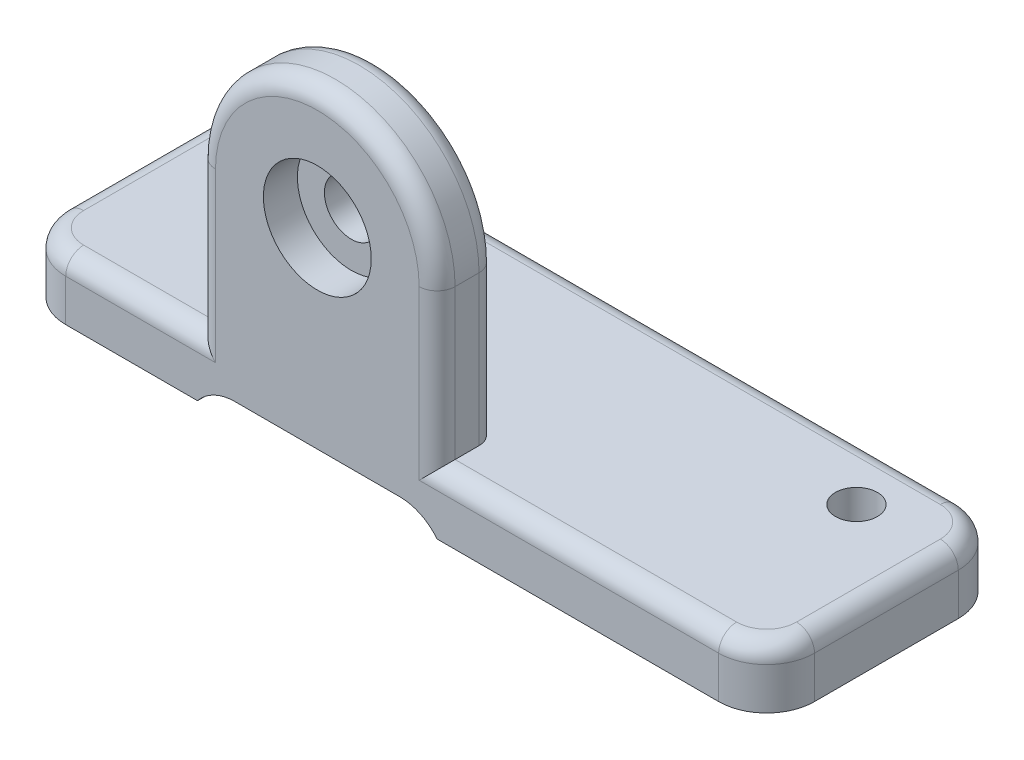
from build123d import *

# Parameters (mm, degrees)
SKETCH2_W                               = 125
SKETCH2_H                               = 40
BOSS_EXTRUDE1_DEPTH                     = 10
BOSS_EXTRUDE2_DEPTH                     = 10
SKETCH4_W                               = 40
SKETCH4_H                               = 3
CUT_EXTRUDE1_DEPTH                      = 80
CBORE_FOR_M8_HEX_HEAD_BOLT1_D           = 9
CBORE_FOR_M8_HEX_HEAD_BOLT1_CBORE_D     = 18.01
CBORE_FOR_M8_HEX_HEAD_BOLT1_CBORE_DEPTH = 5.68
FILLET2_R                               = 8
FILLET3_R                               = 3
F_7_0_7_DIAMETER_HOLE1_D                = 7


with BuildPart() as part:
    # Sketch2 → Boss-Extrude1 (new body)
    with BuildSketch(Plane(origin=(0, 0, 0), x_dir=(1, 0, 0), z_dir=(0, 1, 0))):
        with Locations((62.5, 20)):
            Rectangle(SKETCH2_W, SKETCH2_H)
    extrude(amount=BOSS_EXTRUDE1_DEPTH)

    # Sketch3 → Boss-Extrude2 (add)
    with BuildSketch(Plane.XY):
        with BuildLine():
            Line((30, 35), (30, 0))
            Line((30, 0), (70, 0))
            Line((70, 0), (70, 35))
            ThreePointArc((70, 35), (50, 55), (30, 35))
        make_face()
    extrude(amount=-BOSS_EXTRUDE2_DEPTH)

    # Sketch4 → Cut-Extrude1 (cut)
    with BuildSketch(Plane.XY):
        with Locations((50, 1.5)):
            Rectangle(SKETCH4_W, SKETCH4_H)
    extrude(amount=-CUT_EXTRUDE1_DEPTH, mode=Mode.SUBTRACT)

    # CBORE for M8 Hex Head Bolt1 (through all)
    with Locations(Plane(origin=(50, 35, 0), x_dir=(1, 0, 0), z_dir=(0, 0, 1))):
        with Locations((0, 0)):
            CounterBoreHole(CBORE_FOR_M8_HEX_HEAD_BOLT1_D / 2, CBORE_FOR_M8_HEX_HEAD_BOLT1_CBORE_D / 2, CBORE_FOR_M8_HEX_HEAD_BOLT1_CBORE_DEPTH)

    # Fillet2
    # the kernel refuses this fillet: 8 mm, written as the material it adds along each edge
    with BuildSketch(Plane(origin=(70, 3, 0), x_dir=(-1, 0, 0), z_dir=(0, 0, -1))) as fillet2_piece_1:
        with BuildLine():
            CenterArc((6.244997998, -8), FILLET2_R, 90, 51.317812547)
            Line((0, -3), (0, 0))
            Line((0, 0), (6.244997998, 0))
        make_face()
    extrude(amount=40)
    with BuildSketch(Plane(origin=(30, 3, 0), x_dir=(0, -1, 0), z_dir=(0, 0, -1))) as fillet2_piece_2:
        with BuildLine():
            CenterArc((8, -6.244997998), FILLET2_R, 128.682187453, 51.317812547)
            Line((0, -6.244997998), (0, 0))
            Line((0, 0), (3, 0))
        make_face()
    extrude(amount=40)
    # the kernel refuses this fillet: 8 mm, written as the material it takes off along each edge
    with BuildSketch(Plane(origin=(125, -20, 0), x_dir=(-1, 0, 0), z_dir=(0, 1, 0)), Plane(origin=(125, -20, -40), x_dir=(0, 0, 1), z_dir=(0, 1, 0))) as fillet2_2_piece_1:
        with BuildLine():
            CenterArc((FILLET2_R, -FILLET2_R), FILLET2_R, 90, 90)
            Line((0, -FILLET2_R), (0, 0))
            Line((0, 0), (FILLET2_R, 0))
        make_face()
    extrude(amount=50, mode=Mode.SUBTRACT)
    with BuildSketch(Plane(origin=(0, -20, -40), x_dir=(0, 0, 1), z_dir=(0, 1, 0)), Plane(origin=(0, -20, 0), x_dir=(1, 0, 0), z_dir=(0, 1, 0))) as fillet2_2_piece_2:
        with BuildLine():
            CenterArc((FILLET2_R, FILLET2_R), FILLET2_R, 180, 90)
            Line((0, FILLET2_R), (0, 0))
            Line((0, 0), (FILLET2_R, 0))
        make_face()
    extrude(amount=50, mode=Mode.SUBTRACT)

    # Fillet3
    fillet3_edges = [part.edges().sort_by_distance(p)[0] for p in [
        (93.5, 10, 0),
        (70, 22.5, -10),
        (30, 22.5, -10),
        (70, 22.5, 0),
        (50, 55, 0),
        (30, 22.5, 0),
        (50, 55, -10),
        (125, 10, -20),
        (19, 10, 0),
        (62.5, 10, -40),
        (0, 10, -20),
        (2.343145751, 10, -2.343145751),
        (2.343145751, 10, -37.656854249),
        (122.656854249, 10, -37.656854249),
        (122.656854249, 10, -2.343145751),
    ]]
    fillet(fillet3_edges, radius=FILLET3_R)

    # Ø7.0 (7) Diameter Hole1 (through all)
    with Locations(Plane(origin=(15, 10, -30), x_dir=(0, 0, 1), z_dir=(0, 1, 0))):
        with Locations((0, 0), (0, 95)):
            Hole(F_7_0_7_DIAMETER_HOLE1_D / 2)


solid = part.part
